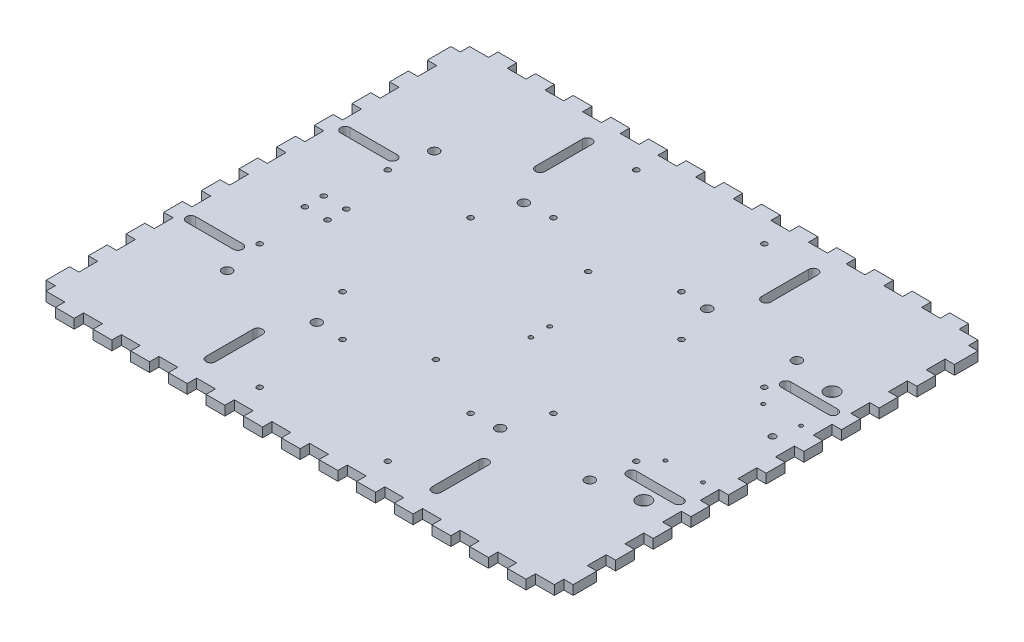
from build123d import *

# Parameters (mm, degrees)
SKETCH1_W               = 355.6
SKETCH1_H               = 298.45
SKETCH1_R               = 1.778
BOSS_EXTRUDE1_DEPTH     = 6.35
SKETCH2_R               = 3.2385
CUT_EXTRUDE1_DEPTH      = 233.209524191
SKETCH8_R               = 4.7625
CUT_EXTRUDE5_DEPTH      = 233.209524191
SKETCH16_W              = 25.4
SKETCH16_H              = 12.7
CUT_EXTRUDE19_DEPTH     = 233.209524191
LPATTERN2_COUNT         = 10
LPATTERN2_PITCH         = 25.4
MIRROR4_COPY_1_SKETCH_W = 25.4
MIRROR4_COPY_1_SKETCH_H = 12.7
MIRROR4_COPY_1_DEPTH    = 233.209524191
MIRROR4_COPY_2_SKETCH_W = 25.4
MIRROR4_COPY_2_SKETCH_H = 12.7
MIRROR4_COPY_2_DEPTH    = 233.209524191
MIRROR4_COPY_3_SKETCH_W = 25.4
MIRROR4_COPY_3_SKETCH_H = 12.7
MIRROR4_COPY_3_DEPTH    = 233.209524191
MIRROR4_COPY_4_SKETCH_W = 25.4
MIRROR4_COPY_4_SKETCH_H = 12.7
MIRROR4_COPY_4_DEPTH    = 233.209524191
MIRROR4_COPY_5_SKETCH_W = 25.4
MIRROR4_COPY_5_SKETCH_H = 12.7
MIRROR4_COPY_5_DEPTH    = 233.209524191
MIRROR4_COPY_6_SKETCH_W = 25.4
MIRROR4_COPY_6_SKETCH_H = 12.7
MIRROR4_COPY_6_DEPTH    = 233.209524191
MIRROR4_COPY_7_SKETCH_W = 25.4
MIRROR4_COPY_7_SKETCH_H = 12.7
MIRROR4_COPY_7_DEPTH    = 233.209524191
MIRROR4_COPY_8_SKETCH_W = 25.4
MIRROR4_COPY_8_SKETCH_H = 12.7
MIRROR4_COPY_8_DEPTH    = 233.209524191
MIRROR4_COPY_9_SKETCH_W = 25.4
MIRROR4_COPY_9_SKETCH_H = 12.7
MIRROR4_COPY_9_DEPTH    = 233.209524191
SKETCH18_W              = 25.4
SKETCH18_H              = 25.4
CUT_EXTRUDE21_DEPTH     = 233.209524191
SKETCH15_W              = 12.7
SKETCH15_H              = 25.4
SKETCH15_W_2            = 25.4
CUT_EXTRUDE22_DEPTH     = 233.209524191
SKETCH19_R              = 1.8415
CUT_EXTRUDE23_DEPTH     = 233.209524191
CIRPATTERN1_COUNT       = 4
CUT_EXTRUDE24_DEPTH     = 233.209524191
SKETCH21_R              = 1.27
SKETCH21_R_2            = 2.2225
CUT_EXTRUDE25_DEPTH     = 233.209524191
MIRROR8_COPY_1_DEPTH    = 233.209524191
SKETCH23_R              = 1.4224
CUT_EXTRUDE27_DEPTH     = 233.209524191
SKETCH26_R              = 1.8415
CUT_EXTRUDE28_DEPTH     = 233.209524191


with BuildPart() as part:
    # Sketch1 → Boss-Extrude1 (new body)
    with BuildSketch(Plane(origin=(0, 0, 0), x_dir=(1, 0, 0), z_dir=(0, 1, 0))):
        Rectangle(SKETCH1_W, SKETCH1_H)
        with Locations(Location((0, 51.3715, 0), (0, 0, 270))):
            Circle(SKETCH1_R, mode=Mode.SUBTRACT)
        with Locations(Location((0, -51.3715, 0), (0, 0, 270))):
            Circle(SKETCH1_R, mode=Mode.SUBTRACT)
    extrude(amount=BOSS_EXTRUDE1_DEPTH)

    # Sketch2 → Cut-Extrude1 (cut, through all)
    with BuildSketch(Plane(origin=(0, 6.35, 0), x_dir=(1, 0, 0), z_dir=(0, 1, 0))):
        with Locations(Location((61.838205, -69.85, 0), (0, 0, 90))):
            Circle(SKETCH2_R)
        with Locations(Location((122.311795, -69.85, 0), (0, 0, 90))):
            Circle(SKETCH2_R)
        with Locations(Location((-122.311795, -69.85, 0), (0, 0, 90))):
            Circle(SKETCH2_R)
        with Locations(Location((-61.838205, -69.85, 0), (0, 0, 90))):
            Circle(SKETCH2_R)
        with Locations(Location((-122.311795, 69.85, 0), (0, 0, 90))):
            Circle(SKETCH2_R)
        with Locations(Location((-61.838205, 69.85, 0), (0, 0, 90))):
            Circle(SKETCH2_R)
        with Locations(Location((61.838205, 69.85, 0), (0, 0, 90))):
            Circle(SKETCH2_R)
        with Locations(Location((122.311795, 69.85, 0), (0, 0, 90))):
            Circle(SKETCH2_R)
    extrude(amount=-CUT_EXTRUDE1_DEPTH, mode=Mode.SUBTRACT)

    # Sketch8 → Cut-Extrude5 (cut, through all)
    with BuildSketch(Plane(origin=(0, 6.35, 0), x_dir=(1, 0, 0), z_dir=(0, 1, 0))):
        with Locations(Location((152.4, 63.5, 0), (0, 0, 270))):
            Circle(SKETCH8_R)
        with Locations(Location((152.4, -63.5, 0), (0, 0, 90))):
            Circle(SKETCH8_R)
    extrude(amount=-CUT_EXTRUDE5_DEPTH, mode=Mode.SUBTRACT)

    # Sketch16 → Cut-Extrude19 (cut, symmetric)
    with BuildSketch(Plane(origin=(0, 6.35, 0), x_dir=(1, 0, 0), z_dir=(0, 1, 0))):
        with Locations((184.15, 114.3)):
            Rectangle(SKETCH16_W, SKETCH16_H)
    cut_extrude19 = extrude(amount=CUT_EXTRUDE19_DEPTH, both=True, mode=Mode.SUBTRACT)

    # LPattern2: Cut-Extrude19 ×10
    with Locations(*[(0, 0, i * LPATTERN2_PITCH) for i in range(1, LPATTERN2_COUNT)]):
        add(cut_extrude19, mode=Mode.SUBTRACT)

    # Mirror4: Cut-Extrude19 across plane
    add(cut_extrude19.mirror(Plane(origin=(0, 0, 0), x_dir=(0, 0, 1), z_dir=(1, 0, 0))), mode=Mode.SUBTRACT)

    # Mirror4 copy 1 sketch → Mirror4 copy 1 (cut, symmetric)
    with BuildSketch(Plane(origin=(0, 6.35, 25.4), x_dir=(-1, 0, 0), z_dir=(0, 1, 0))):
        with Locations((184.15, -114.3)):
            Rectangle(MIRROR4_COPY_1_SKETCH_W, MIRROR4_COPY_1_SKETCH_H)
    extrude(amount=MIRROR4_COPY_1_DEPTH, both=True, mode=Mode.SUBTRACT)

    # Mirror4 copy 2 sketch → Mirror4 copy 2 (cut, symmetric)
    with BuildSketch(Plane(origin=(0, 6.35, 50.8), x_dir=(-1, 0, 0), z_dir=(0, 1, 0))):
        with Locations((184.15, -114.3)):
            Rectangle(MIRROR4_COPY_2_SKETCH_W, MIRROR4_COPY_2_SKETCH_H)
    extrude(amount=MIRROR4_COPY_2_DEPTH, both=True, mode=Mode.SUBTRACT)

    # Mirror4 copy 3 sketch → Mirror4 copy 3 (cut, symmetric)
    with BuildSketch(Plane(origin=(0, 6.35, 76.2), x_dir=(-1, 0, 0), z_dir=(0, 1, 0))):
        with Locations((184.15, -114.3)):
            Rectangle(MIRROR4_COPY_3_SKETCH_W, MIRROR4_COPY_3_SKETCH_H)
    extrude(amount=MIRROR4_COPY_3_DEPTH, both=True, mode=Mode.SUBTRACT)

    # Mirror4 copy 4 sketch → Mirror4 copy 4 (cut, symmetric)
    with BuildSketch(Plane(origin=(0, 6.35, 101.6), x_dir=(-1, 0, 0), z_dir=(0, 1, 0))):
        with Locations((184.15, -114.3)):
            Rectangle(MIRROR4_COPY_4_SKETCH_W, MIRROR4_COPY_4_SKETCH_H)
    extrude(amount=MIRROR4_COPY_4_DEPTH, both=True, mode=Mode.SUBTRACT)

    # Mirror4 copy 5 sketch → Mirror4 copy 5 (cut, symmetric)
    with BuildSketch(Plane(origin=(0, 6.35, 127), x_dir=(-1, 0, 0), z_dir=(0, 1, 0))):
        with Locations((184.15, -114.3)):
            Rectangle(MIRROR4_COPY_5_SKETCH_W, MIRROR4_COPY_5_SKETCH_H)
    extrude(amount=MIRROR4_COPY_5_DEPTH, both=True, mode=Mode.SUBTRACT)

    # Mirror4 copy 6 sketch → Mirror4 copy 6 (cut, symmetric)
    with BuildSketch(Plane(origin=(0, 6.35, 152.4), x_dir=(-1, 0, 0), z_dir=(0, 1, 0))):
        with Locations((184.15, -114.3)):
            Rectangle(MIRROR4_COPY_6_SKETCH_W, MIRROR4_COPY_6_SKETCH_H)
    extrude(amount=MIRROR4_COPY_6_DEPTH, both=True, mode=Mode.SUBTRACT)

    # Mirror4 copy 7 sketch → Mirror4 copy 7 (cut, symmetric)
    with BuildSketch(Plane(origin=(0, 6.35, 177.8), x_dir=(-1, 0, 0), z_dir=(0, 1, 0))):
        with Locations((184.15, -114.3)):
            Rectangle(MIRROR4_COPY_7_SKETCH_W, MIRROR4_COPY_7_SKETCH_H)
    extrude(amount=MIRROR4_COPY_7_DEPTH, both=True, mode=Mode.SUBTRACT)

    # Mirror4 copy 8 sketch → Mirror4 copy 8 (cut, symmetric)
    with BuildSketch(Plane(origin=(0, 6.35, 203.2), x_dir=(-1, 0, 0), z_dir=(0, 1, 0))):
        with Locations((184.15, -114.3)):
            Rectangle(MIRROR4_COPY_8_SKETCH_W, MIRROR4_COPY_8_SKETCH_H)
    extrude(amount=MIRROR4_COPY_8_DEPTH, both=True, mode=Mode.SUBTRACT)

    # Mirror4 copy 9 sketch → Mirror4 copy 9 (cut, symmetric)
    with BuildSketch(Plane(origin=(0, 6.35, 228.6), x_dir=(-1, 0, 0), z_dir=(0, 1, 0))):
        with Locations((184.15, -114.3)):
            Rectangle(MIRROR4_COPY_9_SKETCH_W, MIRROR4_COPY_9_SKETCH_H)
    extrude(amount=MIRROR4_COPY_9_DEPTH, both=True, mode=Mode.SUBTRACT)

    # Sketch18 → Cut-Extrude21 (cut, through all)
    with BuildSketch(Plane(origin=(0, 6.35, 0), x_dir=(1, 0, 0), z_dir=(0, 1, 0))):
        with Locations((184.15, 149.225)):
            Rectangle(SKETCH18_W, SKETCH18_H)
        with Locations((-184.15, 149.225)):
            Rectangle(SKETCH18_W, SKETCH18_H)
        with Locations((184.15, -149.225)):
            Rectangle(SKETCH18_W, SKETCH18_H)
        with Locations((-184.15, -149.225)):
            Rectangle(SKETCH18_W, SKETCH18_H)
    extrude(amount=-CUT_EXTRUDE21_DEPTH, mode=Mode.SUBTRACT)

    # Sketch15 → Cut-Extrude22 (cut, through all)
    with BuildSketch(Plane(origin=(0, 6.35, 0), x_dir=(1, 0, 0), z_dir=(0, 1, 0))):
        with Locations((139.7, 155.575)):
            Rectangle(SKETCH15_W, SKETCH15_H)
        with Locations((114.3, 155.575)):
            Rectangle(SKETCH15_W, SKETCH15_H)
        with Locations((88.9, 155.575)):
            Rectangle(SKETCH15_W, SKETCH15_H)
        with Locations((63.5, 155.575)):
            Rectangle(SKETCH15_W, SKETCH15_H)
        with Locations((38.1, 155.575)):
            Rectangle(SKETCH15_W, SKETCH15_H)
        with Locations((12.7, 155.575)):
            Rectangle(SKETCH15_W, SKETCH15_H)
        with Locations((-12.7, 155.575)):
            Rectangle(SKETCH15_W, SKETCH15_H)
        with Locations((-38.1, 155.575)):
            Rectangle(SKETCH15_W, SKETCH15_H)
        with Locations((-63.5, 155.575)):
            Rectangle(SKETCH15_W, SKETCH15_H)
        with Locations((-88.9, 155.575)):
            Rectangle(SKETCH15_W, SKETCH15_H)
        with Locations((-114.3, 155.575)):
            Rectangle(SKETCH15_W, SKETCH15_H)
        with Locations((-139.7, 155.575)):
            Rectangle(SKETCH15_W, SKETCH15_H)
        with Locations((171.45, 155.575)):
            Rectangle(SKETCH15_W_2, SKETCH15_H)
        with Locations((-171.45, 155.575)):
            Rectangle(SKETCH15_W_2, SKETCH15_H)
    cut_extrude22 = extrude(amount=-CUT_EXTRUDE22_DEPTH, mode=Mode.SUBTRACT)

    # Mirror5: Cut-Extrude22 across plane
    add(cut_extrude22.mirror(Plane.XY), mode=Mode.SUBTRACT)

    # Sketch19 → Cut-Extrude23 (cut, through all)
    with BuildSketch(Plane(origin=(0, 6.35, 0), x_dir=(1, 0, 0), z_dir=(0, 1, 0))):
        with Locations(Location((-43.18, 127, 0), (0, 0, 270))):
            Circle(SKETCH19_R)
        with Locations(Location((43.18, 127, 0), (0, 0, 90))):
            Circle(SKETCH19_R)
        with Locations(Location((43.18, 71.12, 0), (0, 0, 270))):
            Circle(SKETCH19_R)
        with Locations(Location((-43.18, 71.12, 0), (0, 0, 90))):
            Circle(SKETCH19_R)
    cut_extrude23 = extrude(amount=-CUT_EXTRUDE23_DEPTH, mode=Mode.SUBTRACT)

    # Mirror6: Cut-Extrude23 across plane
    add(cut_extrude23.mirror(Plane.XY), mode=Mode.SUBTRACT)

    # CirPattern1: Cut-Extrude23 ×4 about axis, 1 skipped
    cirpattern1_axis = Axis((0, 0, 0), (0, -1, 0))
    add([cut_extrude23.rotate(cirpattern1_axis, i * 360 / CIRPATTERN1_COUNT) for i in range(1, CIRPATTERN1_COUNT) if i not in (2,)], mode=Mode.SUBTRACT)

    # Sketch20 → Cut-Extrude24 (cut, through all)
    with BuildSketch(Plane(origin=(0, 6.35, 0), x_dir=(1, 0, 0), z_dir=(0, 1, 0))):
        with BuildLine():
            Line((132.715, -48.895), (164.465, -48.895))
            ThreePointArc((164.465, -48.895), (167.64, -52.07), (164.465, -55.245))
            Line((164.465, -55.245), (132.715, -55.245))
            ThreePointArc((132.715, -55.245), (129.54, -52.07), (132.715, -48.895))
        make_face()
    cut_extrude24 = extrude(amount=-CUT_EXTRUDE24_DEPTH, mode=Mode.SUBTRACT)

    # Mirror7: Cut-Extrude24 across plane
    add(cut_extrude24.mirror(Plane.XY), mode=Mode.SUBTRACT)

    # Sketch21 → Cut-Extrude25 (cut, through all)
    with BuildSketch(Plane(origin=(0, 6.35, 0), x_dir=(1, 0, 0), z_dir=(0, 1, 0))):
        with Locations(Location((161.847815823, -32.955947829, 0), (0, 0, 270))):
            Circle(SKETCH21_R)
        with Locations(Location((136.447816468, -32.961673137, 0), (0, 0, 270))):
            Circle(SKETCH21_R)
        with Locations(Location((161.832930022, 33.084050494, 0), (0, 0, 270))):
            Circle(SKETCH21_R)
        with Locations(Location((158.42149152, 17.283281134, 0), (0, 0, 270))):
            Circle(SKETCH21_R_2)
        with Locations(Location((136.432930667, 33.078325185, 0), (0, 0, 270))):
            Circle(SKETCH21_R)
    extrude(amount=-CUT_EXTRUDE25_DEPTH, mode=Mode.SUBTRACT)

    # Mirror8: Cut-Extrude24 across plane
    add(cut_extrude24.mirror(Plane(origin=(0, 0, 0), x_dir=(0, 0, 1), z_dir=(1, 0, 0))), mode=Mode.SUBTRACT)

    # Mirror8 copy 1 sketch → Mirror8 copy 1 (cut, through all)
    with BuildSketch(Plane(origin=(0, 6.35, 0), x_dir=(-1, 0, 0), z_dir=(0, 1, 0))):
        with BuildLine():
            Line((132.715, -48.895), (164.465, -48.895))
            ThreePointArc((164.465, -48.895), (167.64, -52.07), (164.465, -55.245))
            Line((164.465, -55.245), (132.715, -55.245))
            ThreePointArc((132.715, -55.245), (129.54, -52.07), (132.715, -48.895))
        make_face()
    extrude(amount=-MIRROR8_COPY_1_DEPTH, mode=Mode.SUBTRACT)

    # Sketch23 → Cut-Extrude27 (cut, through all)
    with BuildSketch(Plane(origin=(0, 6.35, 0), x_dir=(1, 0, 0), z_dir=(0, 1, 0))):
        with Locations(Location((19.05, -6.35, 0), (0, 0, 270))):
            Circle(SKETCH23_R)
        with Locations(Location((19.05, 6.35, 0), (0, 0, 270))):
            Circle(SKETCH23_R)
    extrude(amount=-CUT_EXTRUDE27_DEPTH, mode=Mode.SUBTRACT)

    # Sketch26 → Cut-Extrude28 (cut, through all)
    with BuildSketch(Plane(origin=(0, 6.35, 0), x_dir=(1, 0, 0), z_dir=(0, 1, 0))):
        with Locations(Location((-118.11, 6.35, 0), (0, 0, 270))):
            Circle(SKETCH26_R)
        with Locations(Location((-118.11, -6.35, 0), (0, 0, 270))):
            Circle(SKETCH26_R)
        with Locations(Location((-133.35, 6.35, 0), (0, 0, 270))):
            Circle(SKETCH26_R)
        with Locations(Location((-133.35, -6.35, 0), (0, 0, 270))):
            Circle(SKETCH26_R)
        with BuildLine():
            Line((-73.025, -95.25), (-73.025, -127))
            ThreePointArc((-73.025, -127), (-76.2, -130.175), (-79.375, -127))
            Line((-79.375, -127), (-79.375, -95.25))
            ThreePointArc((-79.375, -95.25), (-76.2, -92.075), (-73.025, -95.25))
        make_face()
        with BuildLine():
            Line((79.375, -95.25), (79.375, -127))
            ThreePointArc((79.375, -127), (76.2, -130.175), (73.025, -127))
            Line((73.025, -127), (73.025, -95.25))
            ThreePointArc((73.025, -95.25), (76.2, -92.075), (79.375, -95.25))
        make_face()
        with BuildLine():
            Line((-73.025, 95.25), (-73.025, 127))
            ThreePointArc((-73.025, 127), (-76.2, 130.175), (-79.375, 127))
            Line((-79.375, 127), (-79.375, 95.25))
            ThreePointArc((-79.375, 95.25), (-76.2, 92.075), (-73.025, 95.25))
        make_face()
        with BuildLine():
            Line((79.375, 95.25), (79.375, 127))
            ThreePointArc((79.375, 127), (76.2, 130.175), (73.025, 127))
            Line((73.025, 127), (73.025, 95.25))
            ThreePointArc((73.025, 95.25), (76.2, 92.075), (79.375, 95.25))
        make_face()
    extrude(amount=-CUT_EXTRUDE28_DEPTH, mode=Mode.SUBTRACT)


solid = part.part
